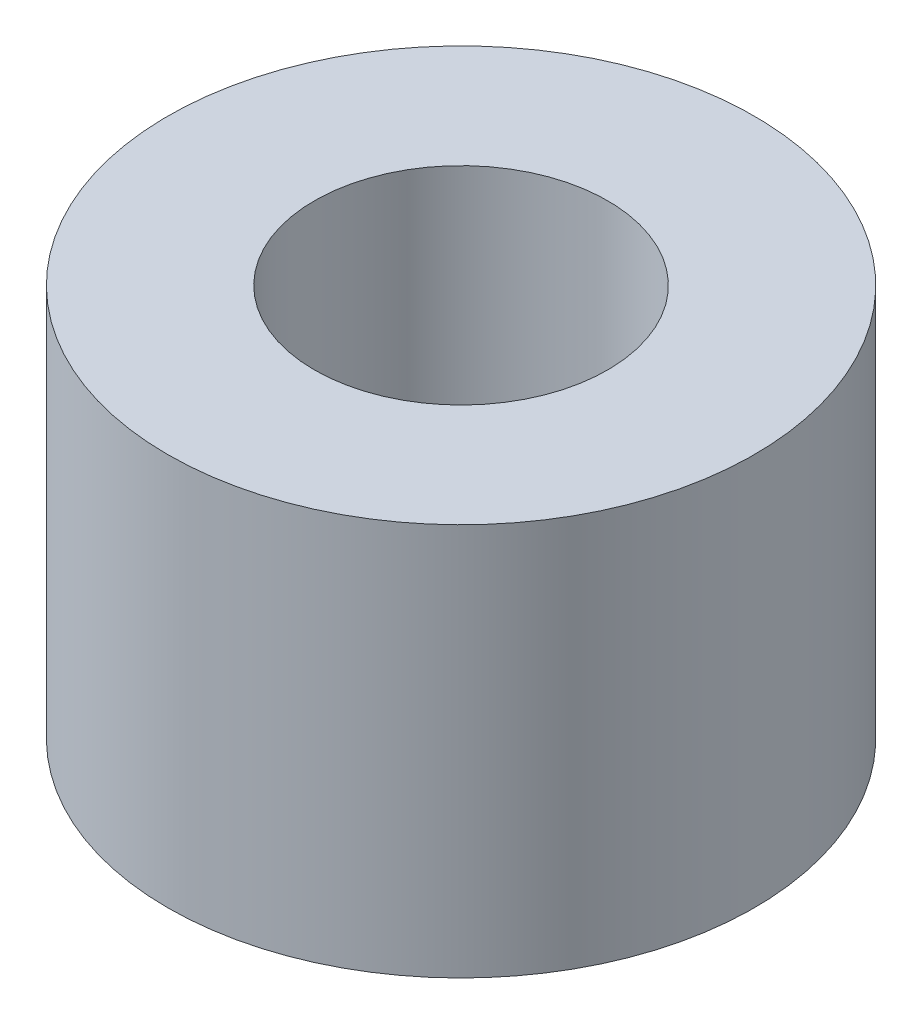
from build123d import *

# Parameters (mm, degrees)
SKETCH1_R           = 12.7
SKETCH1_R_2         = 6.35
BOSS_EXTRUDE1_DEPTH = 17


with BuildPart() as part:
    # Sketch1 → Boss-Extrude1 (new body)
    with BuildSketch(Plane(origin=(0, 0, 0), x_dir=(1, 0, 0), z_dir=(0, 1, 0))):
        Circle(SKETCH1_R)
        Circle(SKETCH1_R_2, mode=Mode.SUBTRACT)
    extrude(amount=BOSS_EXTRUDE1_DEPTH)


solid = part.part
